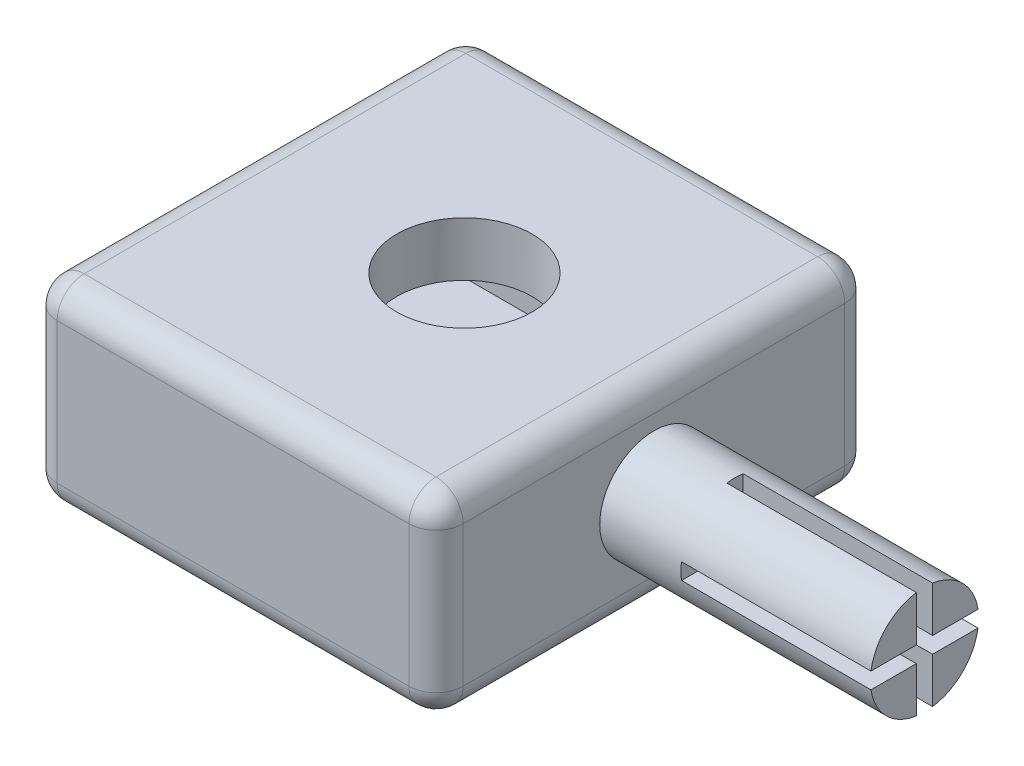
from build123d import *

# Parameters (mm, degrees)
BOSS_EXTRUDE1_DEPTH = 3.2
SKETCH2_W           = 15
SKETCH2_H           = 16.1
BOSS_EXTRUDE2_DEPTH = 2
SKETCH3_W           = 15
SKETCH3_H           = 16.1
BOSS_EXTRUDE3_DEPTH = 2
FILLET1_R           = 1
SKETCH4_R           = 2
BOSS_EXTRUDE4_DEPTH = 10
CUT_EXTRUDE1_START  = -7
CUT_EXTRUDE1_DEPTH  = 7
SKETCH6_R           = 2.5
CUT_EXTRUDE2_DEPTH  = 31.594934221


with BuildPart() as part:
    # Sketch1 → Boss-Extrude1 (new body)
    with BuildSketch(Plane(origin=(0, 0, 0), x_dir=(1, 0, 0), z_dir=(0, 1, 0))):
        with BuildLine():
            Line((0, 13.1), (0, 16.1))
            Line((0, 16.1), (15, 16.1))
            Line((15, 16.1), (15, 0))
            Line((15, 0), (0, 0))
            Line((0, 0), (0, 3))
            Line((0, 3), (8, 3))
            ThreePointArc((8, 3), (13.05, 8.05), (8, 13.1))
            Line((8, 13.1), (0, 13.1))
        make_face()
    extrude(amount=BOSS_EXTRUDE1_DEPTH)

    # Sketch2 → Boss-Extrude2 (add)
    with BuildSketch(Plane(origin=(0, 3.2, 0), x_dir=(1, 0, 0), z_dir=(0, 1, 0))):
        with Locations((7.5, 8.05)):
            Rectangle(SKETCH2_W, SKETCH2_H)
    extrude(amount=BOSS_EXTRUDE2_DEPTH)

    # Sketch3 → Boss-Extrude3 (add)
    with BuildSketch(Plane.XZ):
        with Locations((7.5, -8.05)):
            Rectangle(SKETCH3_W, SKETCH3_H)
    extrude(amount=BOSS_EXTRUDE3_DEPTH)

    # Fillet1
    fillet1_edges = [part.edges().sort_by_distance(p)[0] for p in [
        (0, 1.6, -3),
        (0, 1.6, -13.1),
        (0, 1.6, -16.1),
        (15, 1.6, -16.1),
        (15, 1.6, 0),
        (0, 1.6, 0),
        (0, 3.2, -8.05),
        (15, 5.2, -8.05),
        (7.5, 5.2, -16.1),
        (0, 5.2, -8.05),
        (7.5, 5.2, 0),
        (0, 0, -8.05),
        (0, -2, -8.05),
        (7.5, -2, -16.1),
        (15, -2, -8.05),
        (7.5, -2, 0),
    ]]
    fillet(fillet1_edges, radius=FILLET1_R - 0.0001)  # a hair under: the kernel refuses the full size

    # Sketch4 → Boss-Extrude4 (add)
    with BuildSketch(Plane(origin=(15, 0, 0), x_dir=(0, 0, -1), z_dir=(1, 0, 0))):
        with Locations(Location((8.05, 1.65, 0), (0, 0, 180))):
            Circle(SKETCH4_R)
    extrude(amount=BOSS_EXTRUDE4_DEPTH)

    # Sketch5 → Cut-Extrude1 (cut)
    with BuildSketch(Plane(origin=(25, 0, 0), x_dir=(0, 0, -1), z_dir=(1, 0, 0)).offset(CUT_EXTRUDE1_START)):
        with BuildLine():
            Line((6.072628007, 1.95), (7.75, 1.95))
            Line((7.75, 1.95), (7.75, 3.627371993))
            ThreePointArc((7.75, 3.627371993), (8.05, 3.65), (8.35, 3.627371993))
            Line((8.35, 3.627371993), (8.35, 1.95))
            Line((8.35, 1.95), (10.027371993, 1.95))
            ThreePointArc((10.027371993, 1.95), (10.05, 1.65), (10.027371993, 1.35))
            Line((10.027371993, 1.35), (8.35, 1.35))
            Line((8.35, 1.35), (8.35, -0.327371993))
            ThreePointArc((8.35, -0.327371993), (8.05, -0.35), (7.75, -0.327371993))
            Line((7.75, -0.327371993), (7.75, 1.35))
            Line((7.75, 1.35), (6.072628007, 1.35))
            ThreePointArc((6.072628007, 1.35), (6.05, 1.65), (6.072628007, 1.95))
        make_face()
    extrude(amount=CUT_EXTRUDE1_DEPTH, mode=Mode.SUBTRACT)

    # Sketch6 → Cut-Extrude2 (cut, through all)
    with BuildSketch(Plane(origin=(0, 5.2, 0), x_dir=(1, 0, 0), z_dir=(0, 1, 0))):
        with Locations(Location((8, 8.05, 0), (0, 0, 270))):
            Circle(SKETCH6_R)
    extrude(amount=-CUT_EXTRUDE2_DEPTH, mode=Mode.SUBTRACT)


solid = part.part
